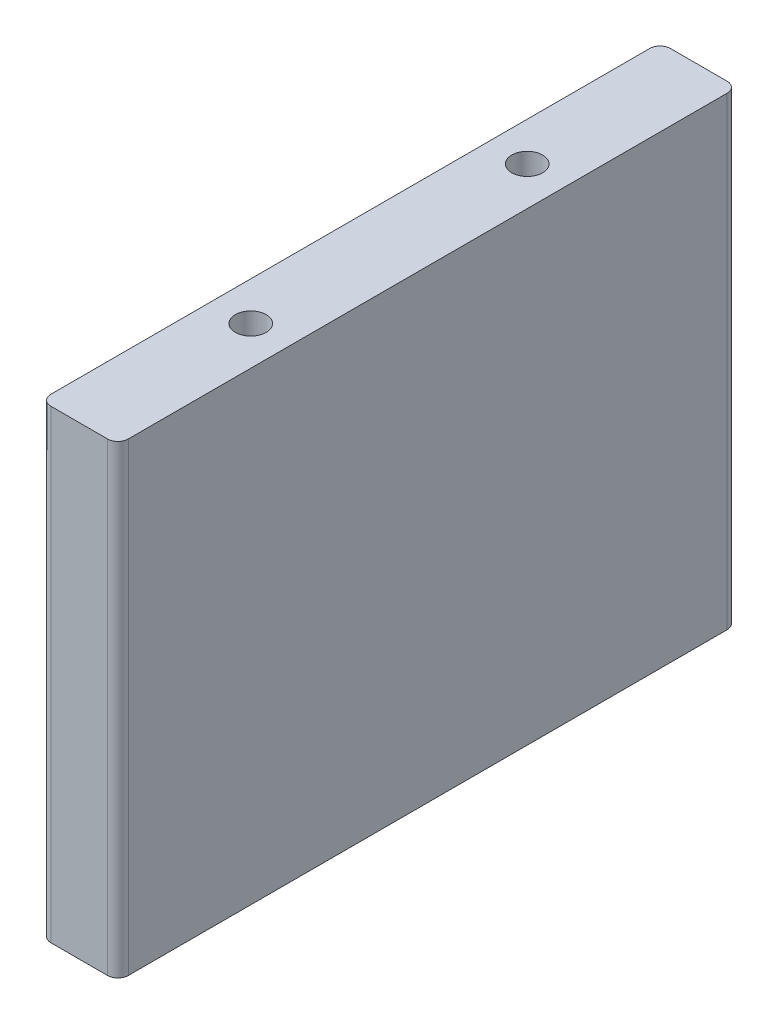
from build123d import *

# Parameters (mm, degrees)
SKETCH1_W                       = 9.525
SKETCH1_H                       = 76.2
BOSS_EXTRUDE1_DEPTH             = 28.575
F_10_24_TAPPED_HOLE1_AT_2_COUNT = 2
F_10_24_TAPPED_HOLE1_AT_2_PITCH = 34
FILLET1_R                       = 1.27


with BuildPart() as part:
    # Sketch1 → Boss-Extrude1 (new, symmetric)
    with BuildSketch(Plane(origin=(0, 0, 0), x_dir=(1, 0, 0), z_dir=(0, 1, 0))):
        Rectangle(SKETCH1_W, SKETCH1_H)
    extrude(amount=BOSS_EXTRUDE1_DEPTH, both=True)

    # Sketch3 → #10-24 Tapped Hole1 (revolve, cut)
    with BuildSketch(Plane(origin=(0, 28.575, -17), x_dir=(0, 0, 1), z_dir=(1, 0, 0))):
        Polygon((0, 0), (0, 20.190824014), (1.89865, 19.05), (1.89865, 0), align=None)
    f_10_24_tapped_hole1 = revolve(axis=Axis((0, 34.925, -17), (0, -1, 0)), mode=Mode.SUBTRACT)

    # #10-24 Tapped Hole1 at 2: #10-24 Tapped Hole1 ×2
    with Locations(*[(0, 0, i * F_10_24_TAPPED_HOLE1_AT_2_PITCH) for i in range(1, F_10_24_TAPPED_HOLE1_AT_2_COUNT)]):
        add(f_10_24_tapped_hole1, mode=Mode.SUBTRACT)

    # Mirror1: #10-24 Tapped Hole1 across plane
    add(f_10_24_tapped_hole1.mirror(Plane.ZX), mode=Mode.SUBTRACT)

    # Mirror1 copy 1 sketch → Mirror1 copy 1 (revolve, cut)
    with BuildSketch(Plane(origin=(0, -28.575, 17), x_dir=(0, 0, 1), z_dir=(1, 0, 0))):
        Polygon((0, 0), (0, -20.190824014), (1.89865, -19.05), (1.89865, 0), align=None)
    revolve(axis=Axis((0, -34.925, 17), (0, -1, 0)), mode=Mode.SUBTRACT)

    # Fillet1
    fillet1_edges = [part.edges().sort_by_distance(p)[0] for p in [
        (4.7625, 0, -38.1),
        (-4.7625, 0, -38.1),
        (4.7625, 0, 38.1),
        (-4.7625, 0, 38.1),
    ]]
    fillet(fillet1_edges, radius=FILLET1_R)


solid = part.part
